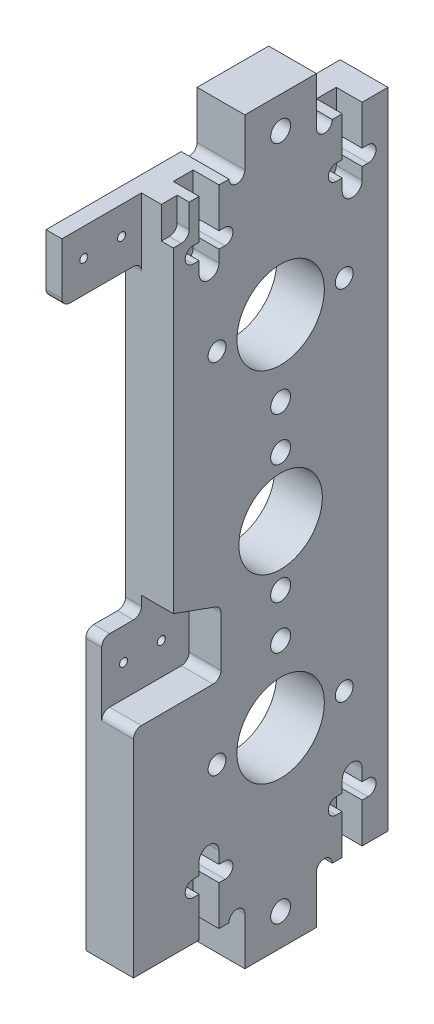
from build123d import *

# Parameters (mm, degrees)
SKETCH2_W                    = 54
SKETCH2_H                    = 162
SKETCH2_R                    = 10.5
SKETCH2_R_2                  = 11
BOSS_EXTRUDE1_DEPTH          = 12
SKETCH3_W                    = 18
SKETCH3_H                    = 12
BOSS_EXTRUDE2_DEPTH          = 12
CUT_EXTRUDE1_REACH           = 99.581
SKETCH4_R                    = 2.25
LPATTERN1_COUNT              = 2
LPATTERN1_PITCH              = 90
CUT_EXTRUDE14_START          = 4
CUT_EXTRUDE14_DEPTH          = 8
CUT_EXTRUDE15_DEPTH          = 6.5
MIRROR2_START                = 4
MIRROR2_COPY_1_DEPTH         = 8
MIRROR2_COPY_2_DEPTH         = 6.5
CUT_EXTRUDE9_REACH           = 99.581
SKETCH13_R                   = 2.5
SKETCH15_W                   = 20
SKETCH15_H                   = 15
BOSS_EXTRUDE3_DEPTH          = 12
F_2_0_2_DIAMETER_HOLE1_D     = 2
SKETCH19_W                   = 10
SKETCH19_H                   = 70
BOSS_EXTRUDE4_DEPTH          = 12
F_2_0_2_DIAMETER_HOLE2_D     = 2
CUT_EXTRUDE12_REACH          = 110.89
CUT_EXTRUDE12_START          = -4
SKETCH22_W                   = 20
SKETCH22_H                   = 15
FILLET1_R                    = 2
CUT_EXTRUDE13_REACH          = 106.89
F_5_0_5_DIAMETER_HOLE2_D     = 5
F_5_0_5_DIAMETER_HOLE1_D     = 5
F_5_0_5_DIAMETER_HOLE1_DEPTH = 12
F_5_0_5_DIAMETER_HOLE1_TIP   = 1.502151548
SKETCH32_W                   = 4
SKETCH32_H                   = 8
CUT_EXTRUDE16_DEPTH          = 3
FILLET2_R                    = 2


# Read off the part's stored shape, not the designer's step: Cut-Extrude14
with BuildPart() as part:
    # Sketch2 → Boss-Extrude1 (new body)
    with BuildSketch(Plane(origin=(0, 0, 0), x_dir=(0, 0, -1), z_dir=(1, 0, 0))):
        Rectangle(SKETCH2_W, SKETCH2_H)
        Circle(SKETCH2_R, mode=Mode.SUBTRACT)
        with Locations((0, 45)):
            Circle(SKETCH2_R_2, mode=Mode.SUBTRACT)
        with Locations((0, -45)):
            Circle(SKETCH2_R_2, mode=Mode.SUBTRACT)
    extrude(amount=BOSS_EXTRUDE1_DEPTH)

    # Sketch3 → Boss-Extrude2 (add)
    with BuildSketch(Plane(origin=(12, 0, 0), x_dir=(0, 0, -1), z_dir=(1, 0, 0))):
        with Locations((0, -87)):
            Rectangle(SKETCH3_W, SKETCH3_H)
    boss_extrude2 = extrude(amount=-BOSS_EXTRUDE2_DEPTH)

    # Mirror1: Boss-Extrude2 across plane
    add(boss_extrude2.mirror(Plane.ZX))

    # Sketch4 → Cut-Extrude1 (cut, up to next)
    with BuildSketch(Plane(origin=(12, 0, 0), x_dir=(0, 0, -1), z_dir=(1, 0, 0)), mode=Mode.PRIVATE) as cut_extrude1_sk1:
        with Locations((-16, -45)):
            Circle(SKETCH4_R)
    cut_extrude1_tool1 = extrude(cut_extrude1_sk1.sketch, amount=-CUT_EXTRUDE1_REACH, mode=Mode.PRIVATE) & part.part
    # Sketch4 → Cut-Extrude1 (cut, up to next)
    with BuildSketch(Plane(origin=(12, 0, 0), x_dir=(0, 0, -1), z_dir=(1, 0, 0)), mode=Mode.PRIVATE) as cut_extrude1_sk2:
        with Locations((16, -45)):
            Circle(SKETCH4_R)
    cut_extrude1_tool2 = extrude(cut_extrude1_sk2.sketch, amount=-CUT_EXTRUDE1_REACH, mode=Mode.PRIVATE) & part.part
    cut_extrude1_1 = cut_extrude1_tool1.solids().sort_by_distance((12, -45, 16))[0]
    add(cut_extrude1_1, mode=Mode.SUBTRACT)
    cut_extrude1_2 = cut_extrude1_tool2.solids().sort_by_distance((12, -45, -16))[0]
    add(cut_extrude1_2, mode=Mode.SUBTRACT)
    cut_extrude1 = cut_extrude1_1 + cut_extrude1_2  # Cut-Extrude1 as one shape, for the pattern or mirror that repeats it

    # LPattern1: Cut-Extrude1 ×2
    with Locations(*[(0, i * LPATTERN1_PITCH, 0) for i in range(1, LPATTERN1_COUNT)]):
        add(cut_extrude1, mode=Mode.SUBTRACT)

    # Cut-Extrude14 outline → Cut-Extrude14 (cut)
    with BuildSketch(Plane.YZ.offset(CUT_EXTRUDE14_START)):
        with BuildLine():
            Line((71, -22), (71, -14))
            ThreePointArc((71, -14), (69, -12), (67, -14))
            Line((67, -14), (67, -22))
            ThreePointArc((67, -22), (69, -24), (71, -22))
        make_face()
    cut_extrude14 = extrude(amount=CUT_EXTRUDE14_DEPTH, mode=Mode.SUBTRACT)

    # Sketch27 → Cut-Extrude15 (cut)
    with BuildSketch(Plane(origin=(12, 165.584173165, 19.767626803), x_dir=(0, 0, -1), z_dir=(1, 0, 0))):
        with BuildLine():
            Line((40.267626803, -47.95431377), (40.267626803, -101.584173165))
            ThreePointArc((40.267626803, -101.584173165), (37.767626803, -104.084173165), (35.267626803, -101.584173165))
            Line((35.267626803, -101.584173165), (35.267626803, -47.95431377))
            ThreePointArc((35.267626803, -47.95431377), (37.767626803, -45.45431377), (40.267626803, -47.95431377))
        make_face()
    cut_extrude15 = extrude(amount=-CUT_EXTRUDE15_DEPTH, mode=Mode.SUBTRACT)

    # Mirror3: Cut-Extrude14, Cut-Extrude15 across plane
    add(cut_extrude14.mirror(Plane.XY), mode=Mode.SUBTRACT)
    add(cut_extrude15.mirror(Plane.XY), mode=Mode.SUBTRACT)

    # Mirror2: Cut-Extrude14, Cut-Extrude15 across plane
    add(cut_extrude14.mirror(Plane.ZX), mode=Mode.SUBTRACT)
    add(cut_extrude15.mirror(Plane.ZX), mode=Mode.SUBTRACT)

    # Mirror2 copy 1 sketch → Mirror2 copy 1 (cut)
    with BuildSketch(Plane(origin=(0, 0, 0), x_dir=(0, -1, 0), z_dir=(1, 0, 0)).offset(MIRROR2_START)):
        with BuildLine():
            Line((71, -22), (71, -14))
            ThreePointArc((71, -14), (69, -12), (67, -14))
            Line((67, -14), (67, -22))
            ThreePointArc((67, -22), (69, -24), (71, -22))
        make_face()
    extrude(amount=MIRROR2_COPY_1_DEPTH, mode=Mode.SUBTRACT)

    # Mirror2 copy 2 sketch → Mirror2 copy 2 (cut)
    with BuildSketch(Plane(origin=(12, -165.584173165, -19.767626803), x_dir=(0, 0, 1), z_dir=(1, 0, 0))):
        with BuildLine():
            Line((40.267626803, -47.95431377), (40.267626803, -101.584173165))
            ThreePointArc((40.267626803, -101.584173165), (37.767626803, -104.084173165), (35.267626803, -101.584173165))
            Line((35.267626803, -101.584173165), (35.267626803, -47.95431377))
            ThreePointArc((35.267626803, -47.95431377), (37.767626803, -45.45431377), (40.267626803, -47.95431377))
        make_face()
    extrude(amount=-MIRROR2_COPY_2_DEPTH, mode=Mode.SUBTRACT)

    # Sketch13 → Cut-Extrude9 (cut, up to next)
    with BuildSketch(Plane.ZY, mode=Mode.PRIVATE) as cut_extrude9_sk1:
        with Locations((0, 15)):
            Circle(SKETCH13_R)
    cut_extrude9_tool1 = extrude(cut_extrude9_sk1.sketch, amount=-CUT_EXTRUDE9_REACH, mode=Mode.PRIVATE) & part.part
    # Sketch13 → Cut-Extrude9 (cut, up to next)
    with BuildSketch(Plane.ZY, mode=Mode.PRIVATE) as cut_extrude9_sk2:
        with Locations((0, -15)):
            Circle(SKETCH13_R)
    cut_extrude9_tool2 = extrude(cut_extrude9_sk2.sketch, amount=-CUT_EXTRUDE9_REACH, mode=Mode.PRIVATE) & part.part
    add(cut_extrude9_tool1.solids().sort_by_distance((0, 15, 0))[0], mode=Mode.SUBTRACT)
    add(cut_extrude9_tool2.solids().sort_by_distance((0, -15, 0))[0], mode=Mode.SUBTRACT)

    # Sketch15 → Boss-Extrude3 (add)
    with BuildSketch(Plane.ZY):
        with Locations((37, 73.5)):
            Rectangle(SKETCH15_W, SKETCH15_H)
    extrude(amount=-BOSS_EXTRUDE3_DEPTH)

    # Ø2.0 (2) Diameter Hole1 (through all)
    with Locations(Plane(origin=(12, 0, 0), x_dir=(0, 0, -1), z_dir=(1, 0, 0))):
        with Locations((-41.5, 74), (-32, 74)):
            Hole(F_2_0_2_DIAMETER_HOLE1_D / 2)

    # Sketch19 → Boss-Extrude4 (add)
    with BuildSketch(Plane.ZY):
        with Locations((32, -46)):
            Rectangle(SKETCH19_W, SKETCH19_H)
    extrude(amount=-BOSS_EXTRUDE4_DEPTH)

    # Ø2.0 (2) Diameter Hole2 (through all)
    with Locations(Plane(origin=(12, 0, 0), x_dir=(0, 0, -1), z_dir=(1, 0, 0))):
        with Locations((-31.5, -19), (-22, -19)):
            Hole(F_2_0_2_DIAMETER_HOLE2_D / 2)

    # Sketch22 → Cut-Extrude12 (cut, up to next)
    with BuildSketch(Plane.ZY.offset(CUT_EXTRUDE12_START), mode=Mode.PRIVATE) as cut_extrude12_sk1:
        with Locations((37, 73.5)):
            Rectangle(SKETCH22_W, SKETCH22_H)
    cut_extrude12_tool1 = extrude(cut_extrude12_sk1.sketch, amount=-CUT_EXTRUDE12_REACH, mode=Mode.PRIVATE) & part.part
    # Sketch22 → Cut-Extrude12 (cut, up to next)
    with BuildSketch(Plane.ZY.offset(CUT_EXTRUDE12_START), mode=Mode.PRIVATE) as cut_extrude12_sk2:
        Polygon((15, -11), (27, -6.632357189), (37, -11), (37, -27), (15, -27), align=None)
    cut_extrude12_tool2 = extrude(cut_extrude12_sk2.sketch, amount=-CUT_EXTRUDE12_REACH, mode=Mode.PRIVATE) & part.part
    add(cut_extrude12_tool1.solids().sort_by_distance((4, 73.5, 37))[0], mode=Mode.SUBTRACT)
    add(cut_extrude12_tool2.solids().sort_by_distance((4, -17.864378, 26.040032))[0], mode=Mode.SUBTRACT)

    # Fillet1
    fillet1_edges = [part.edges().sort_by_distance(p)[0] for p in [
        (8, -11, 15),
        (8, -27, 15),
        (2, 66, 27),
        (2, -11, 27),
        (2, 66, 47),
        (2, -11, 37),
        (8, -27, 37),
    ]]
    fillet(fillet1_edges, radius=FILLET1_R)

    # Sketch23 → Cut-Extrude13 (cut, up to next)
    with BuildSketch(Plane.ZY, mode=Mode.PRIVATE) as cut_extrude13_sk1:
        with BuildLine():
            Line((-13, 81), (-9, 81))
            ThreePointArc((-9, 81), (-11, 79), (-13, 81))
        make_face()
    cut_extrude13_tool1 = extrude(cut_extrude13_sk1.sketch, amount=-CUT_EXTRUDE13_REACH, mode=Mode.PRIVATE) & part.part
    # Sketch23 → Cut-Extrude13 (cut, up to next)
    with BuildSketch(Plane.ZY, mode=Mode.PRIVATE) as cut_extrude13_sk2:
        with BuildLine():
            Line((9, 81), (13, 81))
            ThreePointArc((13, 81), (11, 79), (9, 81))
        make_face()
    cut_extrude13_tool2 = extrude(cut_extrude13_sk2.sketch, amount=-CUT_EXTRUDE13_REACH, mode=Mode.PRIVATE) & part.part
    # Sketch23 → Cut-Extrude13 (cut, up to next)
    with BuildSketch(Plane.ZY, mode=Mode.PRIVATE) as cut_extrude13_sk3:
        with BuildLine():
            Line((-13, -81), (-9, -81))
            ThreePointArc((-9, -81), (-11, -79), (-13, -81))
        make_face()
    cut_extrude13_tool3 = extrude(cut_extrude13_sk3.sketch, amount=-CUT_EXTRUDE13_REACH, mode=Mode.PRIVATE) & part.part
    # Sketch23 → Cut-Extrude13 (cut, up to next)
    with BuildSketch(Plane.ZY, mode=Mode.PRIVATE) as cut_extrude13_sk4:
        with BuildLine():
            Line((9, -81), (13, -81))
            ThreePointArc((13, -81), (11, -79), (9, -81))
        make_face()
    cut_extrude13_tool4 = extrude(cut_extrude13_sk4.sketch, amount=-CUT_EXTRUDE13_REACH, mode=Mode.PRIVATE) & part.part
    add(cut_extrude13_tool1.solids().sort_by_distance((0, 80.151174, -11))[0], mode=Mode.SUBTRACT)
    add(cut_extrude13_tool2.solids().sort_by_distance((0, 80.151174, 11))[0], mode=Mode.SUBTRACT)
    add(cut_extrude13_tool3.solids().sort_by_distance((0, -80.151174, -11))[0], mode=Mode.SUBTRACT)
    add(cut_extrude13_tool4.solids().sort_by_distance((0, -80.151174, 11))[0], mode=Mode.SUBTRACT)

    # Ø5.0 (5) Diameter Hole2 (through all)
    with Locations(Plane(origin=(12, 0, 0), x_dir=(0, 0, -1), z_dir=(1, 0, 0))):
        with Locations((0, -26), (0, 26)):
            Hole(F_5_0_5_DIAMETER_HOLE2_D / 2)

    # Ø5.0 (5) Diameter Hole1
    with Locations(Plane.ZY):
        with Locations((0, 85), (0, -85)):
            Hole(F_5_0_5_DIAMETER_HOLE1_D / 2, depth=F_5_0_5_DIAMETER_HOLE1_DEPTH)
            with Locations((0, 0, -(F_5_0_5_DIAMETER_HOLE1_DEPTH + F_5_0_5_DIAMETER_HOLE1_TIP / 2))):  # 118° drill point
                Cone(0, F_5_0_5_DIAMETER_HOLE1_D / 2, F_5_0_5_DIAMETER_HOLE1_TIP, mode=Mode.SUBTRACT)

    # Sketch32 → Cut-Extrude16 (cut)
    with BuildSketch(Plane(origin=(12, 0, 0), x_dir=(0, 0, -1), z_dir=(1, 0, 0))):
        with Locations((-25, 77)):
            Rectangle(SKETCH32_W, SKETCH32_H)
    extrude(amount=-CUT_EXTRUDE16_DEPTH, mode=Mode.SUBTRACT)

    # Fillet2
    fillet2_edges = [part.edges().sort_by_distance(p)[0] for p in [
        (10.5, 73, 23),
    ]]
    fillet(fillet2_edges, radius=FILLET2_R)


solid = part.part
